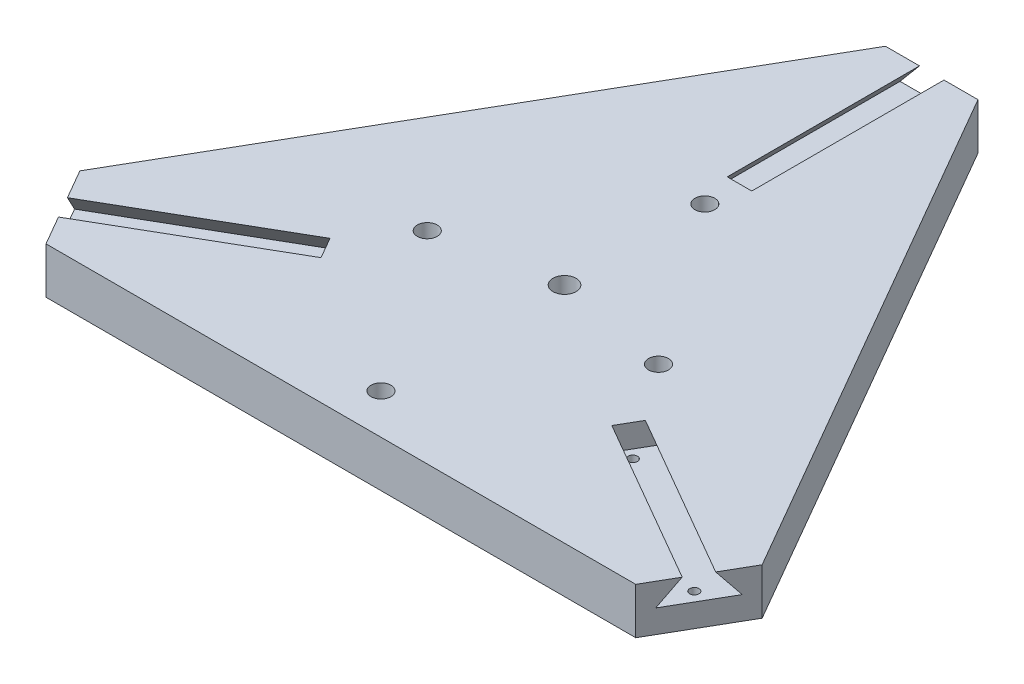
from build123d import *

# Parameters (mm, degrees)
ESQUISSE1_R                  = 2.5
BOSS_EXTRU_1_DEPTH           = 5
ESQUISSE2_R                  = 1
ENL_V_MAT_EXTRU_1_DEPTH      = 109.799753466
R_P_TITION_CIRCULAIRE1_COUNT = 3
ENL_V_MAT_EXTRU_2_DEPTH      = 41.553
R_P_TITION_CIRCULAIRE2_COUNT = 3
ESQUISSE4_R                  = 2.15
ENL_V_MAT_EXTRU_3_DEPTH      = 109.799753466


with BuildPart() as part:
    # Esquisse1 → Boss.-Extru.1 (new, symmetric)
    with BuildSketch(Plane(origin=(0, 0, 0), x_dir=(1, 0, 0), z_dir=(0, 1, 0))):
        Polygon((-10, 79.372539332), (10, 79.372539332), (73.738635424, -31.026015628), (63.738635424, -48.346523704), (-63.738635424, -48.346523704), (-73.738635424, -31.026015628), align=None)
        Circle(ESQUISSE1_R, mode=Mode.SUBTRACT)
    extrude(amount=BOSS_EXTRU_1_DEPTH, both=True)

    # Esquisse2 → Enlèv. mat.-Extru.1 (cut, through all)
    with BuildSketch(Plane(origin=(0, 5, 0), x_dir=(1, 0, 0), z_dir=(0, 1, 0))):
        with Locations((-66.357065564, -38.311269666)):
            Circle(ESQUISSE2_R)
        with Locations((-34.920343407, -20.161269666)):
            Circle(ESQUISSE2_R)
    enl_v_mat_extru_1 = extrude(amount=-ENL_V_MAT_EXTRU_1_DEPTH, mode=Mode.SUBTRACT)

    # Répétition circulaire1: Enlèv. mat.-Extru.1 ×3 about axis
    r_p_tition_circulaire1_axis = Axis((0, 5, 0), (0, -1, 0))
    for i in range(1, R_P_TITION_CIRCULAIRE1_COUNT):
        add(enl_v_mat_extru_1.rotate(r_p_tition_circulaire1_axis, i * 360 / R_P_TITION_CIRCULAIRE1_COUNT), mode=Mode.SUBTRACT)

    # Esquisse3 → Enlèv. mat.-Extru.2 (cut)
    with BuildSketch(Plane(origin=(68.738635424, 0, 39.686269666), x_dir=(0.5000000000000043, 0, -0.8660254037844363), z_dir=(0.8660254037844362, 0, 0.5000000000000042))):
        Polygon((2.65, 5), (6.845, 0), (-6.845, 0), (-2.65, 5), align=None)
    enl_v_mat_extru_2 = extrude(amount=-ENL_V_MAT_EXTRU_2_DEPTH, mode=Mode.SUBTRACT)

    # Répétition circulaire2: Enlèv. mat.-Extru.2 ×3 about axis
    r_p_tition_circulaire2_axis = Axis((0, 5, 0), (0, -1, 0))
    for i in range(1, R_P_TITION_CIRCULAIRE2_COUNT):
        add(enl_v_mat_extru_2.rotate(r_p_tition_circulaire2_axis, i * 360 / R_P_TITION_CIRCULAIRE2_COUNT), mode=Mode.SUBTRACT)

    # Esquisse4 → Enlèv. mat.-Extru.3 (cut, through all)
    with BuildSketch(Plane.XZ.offset(5)):
        with Locations((0, -30.322539332)):
            Circle(ESQUISSE4_R)
        with Locations((0, 39.68)):
            Circle(ESQUISSE4_R)
        with Locations((25, 4.68)):
            Circle(ESQUISSE4_R)
        with Locations((-25, 4.68)):
            Circle(ESQUISSE4_R)
    extrude(amount=-ENL_V_MAT_EXTRU_3_DEPTH, mode=Mode.SUBTRACT)


solid = part.part
